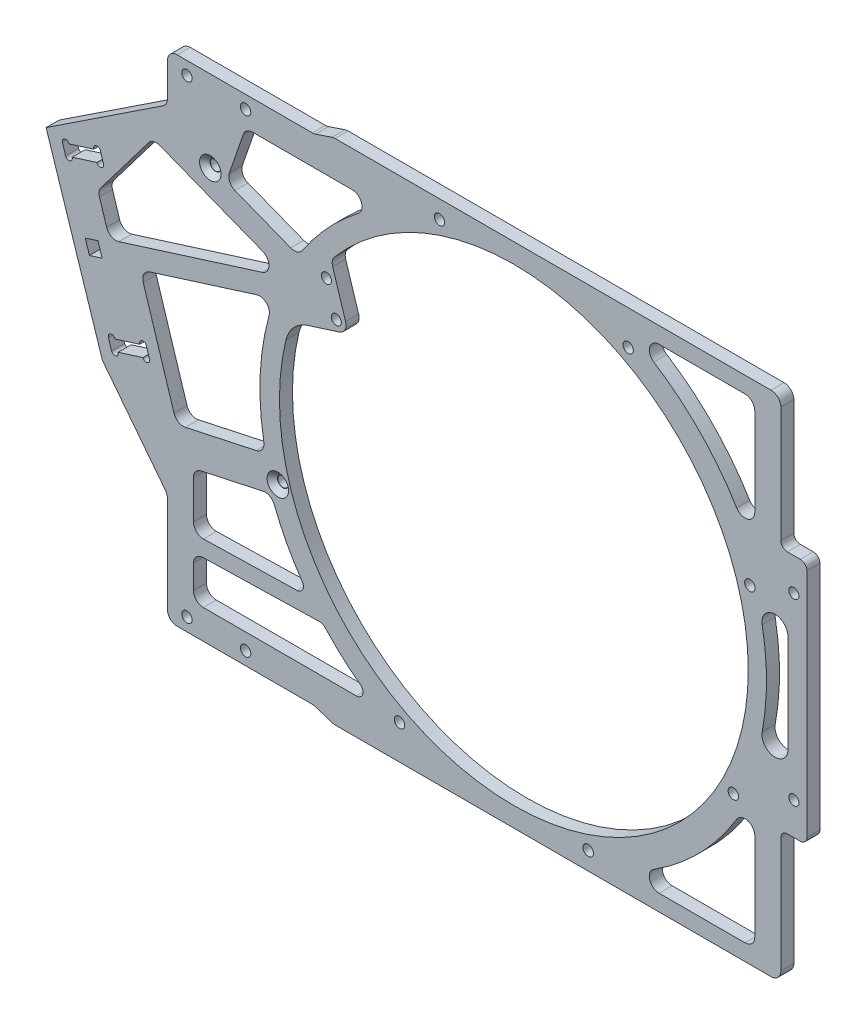
from build123d import *

# Parameters (mm, degrees)
SKETCH_1_W           = 232.8
SKETCH_1_H           = 162
SKETCH_1_R           = 72
EXTRUDE_1_DEPTH      = 4
EXTRUDE_2_DEPTH      = 4
CUT_EXTRUDE_1_DEPTH  = 10
CUT_EXTRUDE_2_DEPTH  = 10
CUT_EXTRUDE_3_DEPTH  = 10
SKETCH_6_R           = 1.05
CUT_EXTRUDE_4_DEPTH  = 10
SKETCH_7_R           = 1.6
CUT_EXTRUDE_5_DEPTH  = 10
SKETCH_9_R           = 1.6
CUT_EXTRUDE_6_DEPTH  = 10
EXTRUDE_5_DEPTH      = 4
SKETCH_14_R          = 1.6
CUT_EXTRUDE_7_DEPTH  = 10
SKETCH_18_R          = 1.6
CUT_EXTRUDE_8_DEPTH  = 10
SKETCH_19_W          = 34.4
SKETCH_19_H          = 162
CUT_EXTRUDE_9_DEPTH  = 10
FILLET_1_R           = 3
CUT_EXTRUDE_10_DEPTH = 10
CUT_EXTRUDE_11_DEPTH = 10
CUT_EXTRUDE_12_DEPTH = 10
FILLET_2_R           = 3
SKETCH_23_W          = 55
SKETCH_23_H          = 21
CUT_EXTRUDE_13_DEPTH = 10
FILLET_3_R           = 5
CUT_EXTRUDE_14_DEPTH = 10
FILLET_4_R           = 3
SKETCH_25_W          = 16
SKETCH_25_H          = 75
EXTRUDE_6_DEPTH      = 4
FILLET_5_R           = 2
SKETCH_26_R          = 1.55
CUT_EXTRUDE_15_DEPTH = 10
EXTRUDE_START        = -4
SKETCH_27_R          = 1.6
EXTRUDE_7_DEPTH      = 4
SKETCH_29_R          = 1.6
EXTRUDE_8_DEPTH      = 4
FILLET_6_R           = 3
CUT_EXTRUDE_16_DEPTH = 10
EXTRUDE_9_DEPTH      = 4
FILLET_7_R           = 2
CUT_EXTRUDE_START    = -10
CUT_EXTRUDE_17_DEPTH = 10
FILLET_8_R           = 3
EXTRUDE_10_DEPTH     = 4
FILLET_9_R           = 3
SKETCH_34_R          = 1.55
CUT_EXTRUDE_18_DEPTH = 33
FILLET_10_R          = 3
FILLET_11_R          = 10
SKETCH_35_W          = 170
SKETCH_35_H          = 10
CUT_EXTRUDE_19_DEPTH = 5
SKETCH_36_R          = 4
CUT_EXTRUDE_20_DEPTH = 5
FILLET_12_R          = 3
SKETCH_37_W          = 10
SKETCH_37_H          = 36
EXTRUDE_11_DEPTH     = 4
CUT_EXTRUDE_21_DEPTH = 4
FILLET_13_R          = 3
CUT_EXTRUDE_22_DEPTH = 10
FILLET_14_R          = 3


# Read off the part's stored shape, not the designer's step: 高级异型孔1
with BuildPart() as part:
    # 草图1 → 凸台-拉伸1 (new body)
    with BuildSketch(Plane.XY):
        Rectangle(SKETCH_1_W, SKETCH_1_H)
        Circle(SKETCH_1_R, mode=Mode.SUBTRACT)
    extrude(amount=EXTRUDE_1_DEPTH)

    # 草图2 → 凸台-拉伸2 (add)
    with BuildSketch(Plane.XY.offset(4)):
        Polygon((-116.4, -29.577095505), (-116.4, 54.548530466), (-143.663539007, 36.519513681), (-126.378953913, -16.748425654), align=None)
        Polygon((-116.4, -81), (-76.4, -81), (-116.4, -29.577095505), align=None)
    extrude(amount=-EXTRUDE_2_DEPTH)

    # 草图3 → 切除-拉伸1 (cut)
    with BuildSketch(Plane.XY.offset(4)):
        Polygon((-116.4, 54.548530466), (-76.4, 81), (-116.4, 81), align=None)
        Polygon((-116.4, -29.577095505), (-76.4, -81), (-116.4, -81), align=None)
    extrude(amount=-CUT_EXTRUDE_1_DEPTH, mode=Mode.SUBTRACT)

    # 草图4 → 切除-拉伸2 (cut)
    with BuildSketch(Plane(origin=(0, 0, 0), x_dir=(-1, 0, 0), z_dir=(0, 0, -1))):
        Polygon((126.46081845, 10.380668775), (130.37134873, 9.148697621), (131.633367961, 13.154606689), (127.722837681, 14.386577843), align=None)
    extrude(amount=-CUT_EXTRUDE_2_DEPTH, mode=Mode.SUBTRACT)

    # 草图5 → 切除-拉伸3 (cut)
    with BuildSketch(Plane.XY.offset(4)):
        Polygon((-124.517208287, -9.766350348), (-123.555669825, -12.818471543), (-111.919457771, -9.152606158), (-112.880996232, -6.100484963), align=None)
        Polygon((-138.639804441, 35.061679699), (-137.678265979, 32.009558504), (-126.042053925, 35.675423889), (-127.003592386, 38.727545084), align=None)
    extrude(amount=-CUT_EXTRUDE_3_DEPTH, mode=Mode.SUBTRACT)

    # 草图6 → 切除-拉伸4 (cut)
    with BuildSketch(Plane.XY.offset(4)):
        with Locations((-123.51573102, -9.45084554)):
            Circle(SKETCH_6_R)
        with Locations((-122.554192558, -12.502966735)):
            Circle(SKETCH_6_R)
        with Locations((-113.882473499, -6.415989771)):
            Circle(SKETCH_6_R)
        with Locations((-112.920935038, -9.468110966)):
            Circle(SKETCH_6_R)
        with Locations((-137.638327174, 35.377184507)):
            Circle(SKETCH_6_R)
        with Locations((-127.043531192, 35.359919081)):
            Circle(SKETCH_6_R)
        with Locations((-128.005069653, 38.412040276)):
            Circle(SKETCH_6_R)
        with Locations((-136.676788712, 32.325063312)):
            Circle(SKETCH_6_R)
    extrude(amount=-CUT_EXTRUDE_4_DEPTH, mode=Mode.SUBTRACT)

    # 草图7 → 切除-拉伸5 (cut)
    with BuildSketch(Plane.XY.offset(4)):
        with Locations((-72.487878374, -22.836538462)):
            Circle(SKETCH_7_R)
        with Locations((22.836538462, -72.487878374)):
            Circle(SKETCH_7_R)
        with Locations((72.487878374, 22.836538462)):
            Circle(SKETCH_7_R)
        with Locations((-22.836538462, 72.487878374)):
            Circle(SKETCH_7_R)
    extrude(amount=-CUT_EXTRUDE_5_DEPTH, mode=Mode.SUBTRACT)

    # 草图9 → 切除-拉伸6 (cut)
    with BuildSketch(Plane.XY.offset(4)):
        with Locations((-93.229198124, 50.99070111)):
            Circle(SKETCH_9_R)
    extrude(amount=-CUT_EXTRUDE_6_DEPTH, mode=Mode.SUBTRACT)

    # 草图13 → 凸台-拉伸5 (add)
    with BuildSketch(Plane.XY.offset(4)):
        Polygon((-116.4, -29.577095505), (-116.4, -81), (-76.4, -81), align=None)
        Polygon((-76.4, 81), (-116.4, 81), (-116.4, 54.548530466), align=None)
    extrude(amount=-EXTRUDE_5_DEPTH)

    # 草图14 → 切除-拉伸7 (cut)
    with BuildSketch(Plane.XY.offset(4)):
        with Locations((-111.4, -55)):
            Circle(SKETCH_14_R)
        with Locations((-81.4, -55)):
            Circle(SKETCH_14_R)
        with Locations((-81.4, 55)):
            Circle(SKETCH_14_R)
        with Locations((-111.4, 55)):
            Circle(SKETCH_14_R)
    extrude(amount=-CUT_EXTRUDE_7_DEPTH, mode=Mode.SUBTRACT)

    # 高级异型孔1 outline → 高级异型孔1 (revolve, cut)
    with BuildSketch(Plane(origin=(-72.487878374, -22.836538462, 0), x_dir=(1, 0, 0), z_dir=(0, -1, 0))):
        Polygon((1.6, 4), (1.6, 2.4), (1.7, 2.4), (3.3, 4), align=None)
    revolve(axis=Axis((-72.487878374, -22.836538462, 0), (0, 0, 1)), mode=Mode.SUBTRACT)

    # Other 1 2 outline → Other 1 2 (revolve, cut)
    with BuildSketch(Plane(origin=(-93.229198124, 50.99070111, 0), x_dir=(1, 0, 0), z_dir=(0, -1, 0))):
        Polygon((1.6, 4), (1.6, 2.4), (1.7, 2.4), (3.3, 4), align=None)
    revolve(axis=Axis((-93.229198124, 50.99070111, 0), (0, 0, 1)), mode=Mode.SUBTRACT)

    # 草图18 → 切除-拉伸8 (cut)
    with BuildSketch(Plane.XY.offset(4)):
        with Locations((67.404541557, -35.108799147)):
            Circle(SKETCH_18_R)
        with Locations((-35.108799147, -67.404541557)):
            Circle(SKETCH_18_R)
        with Locations((35.108799147, 67.404541557)):
            Circle(SKETCH_18_R)
    extrude(amount=-CUT_EXTRUDE_8_DEPTH, mode=Mode.SUBTRACT)

    # 草图19 → 切除-拉伸9 (cut)
    with BuildSketch(Plane.XY.offset(4)):
        with Locations((99.2, 0)):
            Rectangle(SKETCH_19_W, SKETCH_19_H)
    extrude(amount=-CUT_EXTRUDE_9_DEPTH, mode=Mode.SUBTRACT)

    # 圆角1
    fillet_1_edges = [part.edges().sort_by_distance(p)[0] for p in [
        (-116.4, -29.577095505, 2),
        (-116.4, -81, 2),
        (-116.4, 54.548530466, 2),
        (-116.4, 81, 2),
        (82, 81, 2),
        (82, -81, 2),
    ]]
    fillet(fillet_1_edges, radius=FILLET_1_R)

    # 草图20 → 切除-拉伸10 (cut)
    with BuildSketch(Plane.XY.offset(4)):
        with BuildLine():
            Line((32.726136344, -73), (74, -73))
            Line((74, -73), (74, -30.397368307))
            ThreePointArc((74, -30.397368307), (57.457489516, -55.665401269), (32.726136344, -73))
        make_face()
        with BuildLine():
            Line((74, 73), (74, 30.397368307))
            ThreePointArc((74, 30.397368307), (57.457489516, 55.665401269), (32.726136344, 73))
            Line((32.726136344, 73), (74, 73))
        make_face()
    extrude(amount=-CUT_EXTRUDE_10_DEPTH, mode=Mode.SUBTRACT)

    # 草图21 → 切除-拉伸11 (cut)
    with BuildSketch(Plane.XY.offset(4)):
        with BuildLine():
            Line((-114.744931277, 13.12802892), (-73.495412458, 26.123253007))
            ThreePointArc((-73.495412458, 26.123253007), (-77.838928848, 5.010105366), (-76.237936677, -16.485660775))
            Line((-76.237936677, -16.485660775), (-103.554536047, -22.39259124))
            Line((-103.554536047, -22.39259124), (-114.744931277, 13.12802892))
        make_face()
        Polygon((-124.178118879, 16.446910006), (-127.736656978, 27.74244314), (-110.836615336, 50.031841617), (-69.201172026, 33.766814926), align=None)
    extrude(amount=-CUT_EXTRUDE_11_DEPTH, mode=Mode.SUBTRACT)

    # 草图22 → 切除-拉伸12 (cut)
    with BuildSketch(Plane.XY.offset(4)):
        with BuildLine():
            Line((-108.4, -33.671499255), (-108.4, -50.5))
            Line((-108.4, -50.5), (-60.75154319, -50.5))
            ThreePointArc((-60.75154319, -50.5), (-68.687001322, -39.026860615), (-74.48068822, -26.336800913))
            Line((-74.48068822, -26.336800913), (-108.4, -33.671499255))
        make_face()
    extrude(amount=-CUT_EXTRUDE_12_DEPTH, mode=Mode.SUBTRACT)

    # 圆角2
    fillet_2_edges = [part.edges().sort_by_distance(p)[0] for p in [
        (32.726136344, -73, 2),
        (74, -30.397368307, 2),
        (74, -73, 2),
        (74, 30.397368307, 2),
        (32.726136344, 73, 2),
        (74, 73, 2),
        (-73.495412458, 26.123253007, 2),
        (-76.237936677, -16.485660775, 2),
        (-103.554536047, -22.39259124, 2),
        (-114.744931277, 13.12802892, 2),
        (-69.201172026, 33.766814926, 2),
        (-124.178118879, 16.446910006, 2),
        (-127.736656978, 27.74244314, 2),
        (-110.836615336, 50.031841617, 2),
        (-108.4, -33.671499255, 2),
        (-74.48068822, -26.336800913, 2),
        (-60.75154319, -50.5, 2),
        (-108.4, -50.5, 2),
    ]]
    fillet(fillet_2_edges, radius=FILLET_2_R)

    # 草图23 → 切除-拉伸13 (cut)
    with BuildSketch(Plane.XY.offset(4)):
        with Locations((-88.9, 70.5)):
            Rectangle(SKETCH_23_W, SKETCH_23_H)
        with Locations((-88.9, -70.5)):
            Rectangle(SKETCH_23_W, SKETCH_23_H)
    extrude(amount=-CUT_EXTRUDE_13_DEPTH, mode=Mode.SUBTRACT)

    # 圆角3
    fillet_3_edges = [part.edges().sort_by_distance(p)[0] for p in [
        (-61.4, -81, 2),
        (-61.4, -60, 2),
        (-116.4, -60, 2),
        (-116.4, 60, 2),
        (-61.4, 60, 2),
        (-61.4, 81, 2),
    ]]
    fillet(fillet_3_edges, radius=FILLET_3_R)

    # 草图24 → 切除-拉伸14 (cut)
    with BuildSketch(Plane.XY.offset(4)):
        with BuildLine():
            Line((-84.963000824, 48.513000941), (-68.773936162, 54))
            Line((-68.773936162, 54), (-56.284989118, 54))
            ThreePointArc((-56.284989118, 54), (-61.592824803, 47.857328935), (-66.233450164, 41.196238655))
            Line((-66.233450164, 41.196238655), (-84.963000824, 48.513000941))
        make_face()
    extrude(amount=-CUT_EXTRUDE_14_DEPTH, mode=Mode.SUBTRACT)

    # 圆角4
    fillet_4_edges = [part.edges().sort_by_distance(p)[0] for p in [
        (-66.233450164, 41.196238655, 2),
        (-84.963000824, 48.513000941, 2),
        (-68.773936162, 54, 2),
        (-56.284989118, 54, 2),
    ]]
    fillet(fillet_4_edges, radius=FILLET_4_R)

    # 草图25 → 凸台-拉伸6 (add)
    with BuildSketch(Plane.XY.offset(4)):
        with Locations((82, 0)):
            Rectangle(SKETCH_25_W, SKETCH_25_H)
    extrude(amount=-EXTRUDE_6_DEPTH)

    # 圆角5
    fillet_5_edges = [part.edges().sort_by_distance(p)[0] for p in [
        (82, 37.5, 2),
        (82, -37.5, 2),
        (90, -37.5, 2),
        (90, 37.5, 2),
    ]]
    fillet(fillet_5_edges, radius=FILLET_5_R)

    # 草图26 → 切除-拉伸15 (cut)
    with BuildSketch(Plane.XY.offset(4)):
        with Locations((86, 27.5)):
            Circle(SKETCH_26_R)
        with Locations((86, -27.5)):
            Circle(SKETCH_26_R)
    extrude(amount=-CUT_EXTRUDE_15_DEPTH, mode=Mode.SUBTRACT)

    # 草图27 → 凸台-拉伸7 (add)
    with BuildSketch(Plane.XY.offset(4).offset(EXTRUDE_START)):
        with BuildLine():
            Line((-61.4, -76), (-116.4, -76))
            Line((-116.4, -76), (-116.4, -55))
            ThreePointArc((-116.4, -55), (-114.935533906, -58.535533906), (-111.4, -60))
            Line((-111.4, -60), (-66.4, -60))
            ThreePointArc((-66.4, -60), (-62.864466094, -61.464466094), (-61.4, -65))
            Line((-61.4, -65), (-61.4, -76))
        make_face()
        with Locations((-100.4, -72)):
            Circle(SKETCH_27_R, mode=Mode.SUBTRACT)
        with Locations((-82.4, -72)):
            Circle(SKETCH_27_R, mode=Mode.SUBTRACT)
    extrude_7 = extrude(amount=EXTRUDE_7_DEPTH)

    # 镜向1: 凸台-拉伸7 across plane
    add(extrude_7.mirror(Plane.ZX))

    # 草图29 → 凸台-拉伸8 (add)
    with BuildSketch(Plane.XY.offset(4)):
        with Locations((-81.4, -55)):
            Circle(SKETCH_29_R)
        with Locations((-111.4, -55)):
            Circle(SKETCH_29_R)
        with Locations((-81.4, 55)):
            Circle(SKETCH_29_R)
        with Locations((-111.4, 55)):
            Circle(SKETCH_29_R)
    extrude(amount=-EXTRUDE_8_DEPTH)

    # 圆角6
    fillet_6_edges = [part.edges().sort_by_distance(p)[0] for p in [
        (-116.4, -76, 2),
        (-116.4, 76, 2),
    ]]
    fillet(fillet_6_edges, radius=FILLET_6_R)

    # 草图30 → 切除-拉伸16 (cut)
    with BuildSketch(Plane.XY.offset(4)):
        with BuildLine():
            Line((-108.4, -47.5), (-108.4, -67))
            Line((-108.4, -67), (-41.856899073, -67))
            ThreePointArc((-41.856899073, -67), (-58.434272898, -53.164233756), (-70.646278361, -35.356800671))
            Line((-70.646278361, -35.356800671), (-108.4, -47.5))
        make_face()
    extrude(amount=-CUT_EXTRUDE_16_DEPTH, mode=Mode.SUBTRACT)

    # 草图31 → 凸台-拉伸9 (add)
    with BuildSketch(Plane.XY.offset(4)):
        with BuildLine():
            Line((-108.4, -54.04675262), (-58.695191086, -52.876029951))
            ThreePointArc((-58.695191086, -52.876029951), (-60.781113079, -50.464406197), (-62.76801864, -47.970572605))
            Line((-62.76801864, -47.970572605), (-108.4, -49.045365892))
            Line((-108.4, -49.045365892), (-108.4, -54.04675262))
        make_face()
    extrude(amount=-EXTRUDE_9_DEPTH)

    # 圆角7
    fillet_7_edges = [part.edges().sort_by_distance(p)[0] for p in [
        (-41.856899073, -67, 2),
        (-108.4, -67, 2),
        (-108.4, -54.04675262, 2),
        (-108.4, -49.045365892, 2),
        (-62.76801864, -47.970572605, 2),
        (-58.695191086, -52.876029951, 2),
    ]]
    fillet(fillet_7_edges, radius=FILLET_7_R)

    # 草图32 → 切除-拉伸17 (cut)
    with BuildSketch(Plane(origin=(0, 0, 0), x_dir=(-1, 0, 0), z_dir=(0, 0, -1)).offset(CUT_EXTRUDE_START)):
        with BuildLine():
            Line((82.4, 67), (39.937451095, 67))
            ThreePointArc((39.937451095, 67), (52.744218552, 57.463444113), (63.340660025, 45.518795981))
            Line((63.340660025, 45.518795981), (77.298392997, 45.518795981))
            Line((77.298392997, 45.518795981), (88.339311065, 49.831967951))
            Line((88.339311065, 49.831967951), (82.4, 67))
        make_face()
    extrude(amount=CUT_EXTRUDE_17_DEPTH, mode=Mode.SUBTRACT)

    # 圆角8
    fillet_8_edges = [part.edges().sort_by_distance(p)[0] for p in [
        (-82.4, 67, 2),
        (-88.339311065, 49.831967951, 2),
        (-39.937451095, 67, 2),
    ]]
    fillet(fillet_8_edges, radius=FILLET_8_R)

    # 草图33 → 凸台-拉伸10 (add)
    with BuildSketch(Plane(origin=(0, 0, 0), x_dir=(-1, 0, 0), z_dir=(0, 0, -1))):
        with BuildLine():
            Line((68.398437808, 22.486745107), (50.771707241, 28.039859911))
            Line((50.771707241, 28.039859911), (56.14025237, 45.080728298))
            ThreePointArc((56.14025237, 45.080728298), (63.285806915, 34.335209962), (68.398437808, 22.486745107))
        make_face()
    extrude(amount=-EXTRUDE_10_DEPTH)

    # 圆角9
    fillet_9_edges = [part.edges().sort_by_distance(p)[0] for p in [
        (-56.14025237, 45.080728298, 2),
    ]]
    fillet(fillet_9_edges, radius=FILLET_9_R)

    # 草图34 → 切除-拉伸18 (cut)
    with BuildSketch(Plane.XY.offset(4)):
        with Locations((-57.539320861, 39.537659957)):
            Circle(SKETCH_34_R)
        with Locations((-54.534513169, 29.999781223)):
            Circle(SKETCH_34_R)
    extrude(amount=-CUT_EXTRUDE_18_DEPTH, mode=Mode.SUBTRACT)

    # 圆角10
    fillet_10_edges = [part.edges().sort_by_distance(p)[0] for p in [
        (-50.771707241, 28.039859911, 2),
    ]]
    fillet(fillet_10_edges, radius=FILLET_10_R)

    # 圆角11
    fillet_11_edges = [part.edges().sort_by_distance(p)[0] for p in [
        (-68.398437808, 22.486745107, 2),
    ]]
    fillet(fillet_11_edges, radius=FILLET_11_R)

    # 草图35 → 切除-拉伸19 (cut, symmetric)
    with BuildSketch(Plane.XY.offset(4)):
        with Locations((0, 83)):
            Rectangle(SKETCH_35_W, SKETCH_35_H)
        with Locations((0, -83)):
            Rectangle(SKETCH_35_W, SKETCH_35_H)
    extrude(amount=CUT_EXTRUDE_19_DEPTH, both=True, mode=Mode.SUBTRACT)

    # 草图36 → 切除-拉伸20 (cut, symmetric)
    with BuildSketch(Plane.XY.offset(4)):
        with Locations((80.208860981, 15)):
            Circle(SKETCH_36_R)
        with BuildLine():
            ThreePointArc((76.277025054, -14.264699893), (80.578087398, -11.017077473), (84.208860981, -15))
            Line((84.208860981, -15), (84.208860981, 15))
            ThreePointArc((84.208860981, 15), (80.57808741, 11.017077475), (76.277025059, 14.264699869))
            ThreePointArc((76.277025059, 14.264699869), (77.268095826, 7.162931077), (77.599395707, 0))
            ThreePointArc((77.599395707, 0), (77.268095825, -7.16293109), (76.277025054, -14.264699893))
        make_face()
        with Locations((80.208860981, -15)):
            Circle(SKETCH_36_R)
    extrude(amount=CUT_EXTRUDE_20_DEPTH, both=True, mode=Mode.SUBTRACT)

    # 圆角12
    fillet_12_edges = [part.edges().sort_by_distance(p)[0] for p in [
        (82, -78, 2),
        (82, 78, 2),
    ]]
    fillet(fillet_12_edges, radius=FILLET_12_R)

    # 草图37 → 凸台-拉伸11 (add)
    with BuildSketch(Plane.XY.offset(4)):
        with Locations((-103.4, -49)):
            Rectangle(SKETCH_37_W, SKETCH_37_H)
    extrude(amount=-EXTRUDE_11_DEPTH)

    # 草图38 → 切除-拉伸21 (cut)
    with BuildSketch(Plane.XY.offset(4)):
        Polygon((-118.4, -76), (-106.4, -76), (-106.4, -42.432821629), (-117.032041711, -28.764559992), (-118.4, -28.764559992), align=None)
        Polygon((-118.4, 76), (-106.4, 76), (-106.4, 61.16139785), (-117.745231167, 53.658946936), (-118.4, 53.658946936), align=None)
    extrude(amount=-CUT_EXTRUDE_21_DEPTH, mode=Mode.SUBTRACT)

    # 圆角13
    fillet_13_edges = [part.edges().sort_by_distance(p)[0] for p in [
        (-98.4, -53.811217529, 2),
        (-98.4, -48.809830802, 2),
        (-98.4, -31.509103275, 2),
        (-98.4, -67, 2),
        (-106.4, -76, 2),
        (-106.4, -42.432821629, 2),
        (-106.4, 76, 2),
        (-106.4, 61.16139785, 2),
    ]]
    fillet(fillet_13_edges, radius=FILLET_13_R)

    # 草图39 → 切除-拉伸22 (cut)
    with BuildSketch(Plane.XY.offset(4)):
        Polygon((-61.4, -76), (-55.4, -78), (-61.4, -78), align=None)
        Polygon((-61.4, 78), (-61.4, 76), (-55.4, 78), align=None)
    extrude(amount=-CUT_EXTRUDE_22_DEPTH, mode=Mode.SUBTRACT)

    # 圆角14
    fillet_14_edges = [part.edges().sort_by_distance(p)[0] for p in [
        (-55.4, -78, 2),
        (-55.4, 78, 2),
        (-61.4, -76, 2),
        (-61.4, 76, 2),
    ]]
    fillet(fillet_14_edges, radius=FILLET_14_R)


solid = part.part
